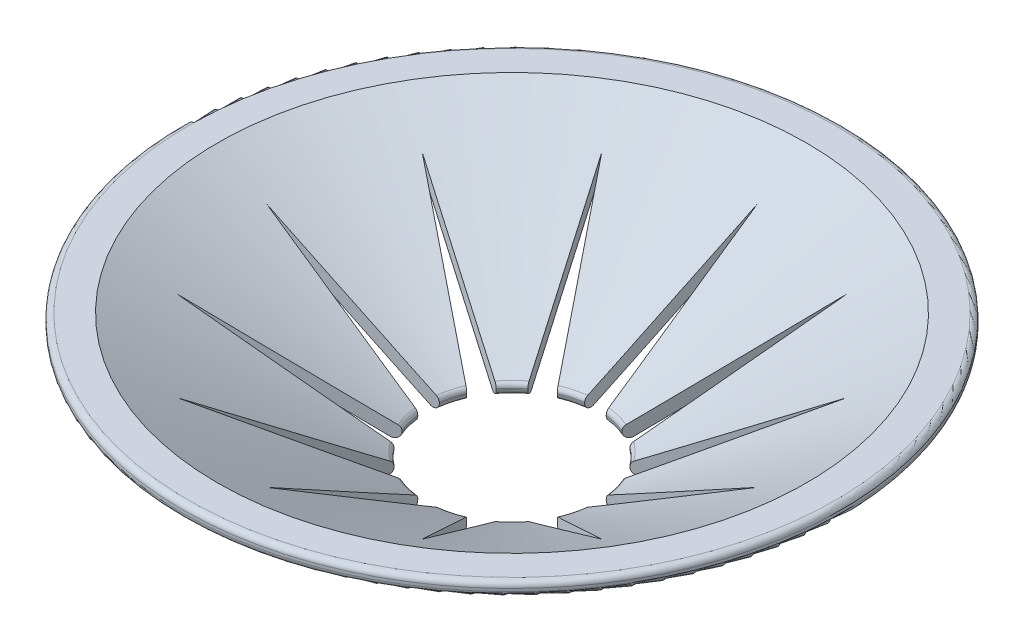
from build123d import *

# Parameters (mm, degrees)
CONG_1_R                = 0.8
ENL_V_MAT_EXTRU_1_DEPTH = 30


with BuildPart() as part:
    # Esquisse2 → Révolution1 (revolve)
    with BuildSketch(Plane.XY):
        Polygon((-47, -2), (-42, -2), (-12, -19.320508076), (-12, -17.320508076), (-42, 0), (-47, 0), align=None)
    revolve(axis=Axis((0, 0, 0), (0, 1, 0)))

    # Congé1
    cong_1_edges = [part.edges().sort_by_distance(p)[0] for p in [
        (47, -2, 0),
        (47, 0, 0),
        (12, -19.320508076, 0),
        (12, -17.320508076, 0),
    ]]
    fillet(cong_1_edges, radius=CONG_1_R)

    # Esquisse4 → Enlèv. mat.-Extru.1 (cut)
    with BuildSketch(Plane(origin=(0, 0, 0), x_dir=(1, 0, 0), z_dir=(0, 1, 0))):
        Polygon((-6.973170189, 1.868455321), (-35, 0), (-6.973170189, -1.868455321), (-30.310889132, -17.5), (-5.104714868, -5.104714868), (-17.5, -30.310889132), (-1.868455321, -6.973170189), (0, -35), (1.868455321, -6.973170189), (17.5, -30.310889132), (5.104714868, -5.104714868), (30.310889132, -17.5), (6.973170189, -1.868455321), (35, 0), (6.973170189, 1.868455321), (30.310889132, 17.5), (5.104714868, 5.104714868), (17.5, 30.310889132), (1.868455321, 6.973170189), (0, 35), (-1.868455321, 6.973170189), (-17.5, 30.310889132), (-5.104714868, 5.104714868), (-30.310889132, 17.5), align=None)
        Polygon((-5, -1.339745962), (-5, 1.339745962), (-3.660254038, 3.660254038), (-1.339745962, 5), (1.339745962, 5), (3.660254038, 3.660254038), (5, 1.339745962), (5, -1.339745962), (3.660254038, -3.660254038), (1.339745962, -5), (-1.339745962, -5), (-3.660254038, -3.660254038), align=None, mode=Mode.SUBTRACT)
    extrude(amount=-ENL_V_MAT_EXTRU_1_DEPTH, mode=Mode.SUBTRACT)


solid = part.part
